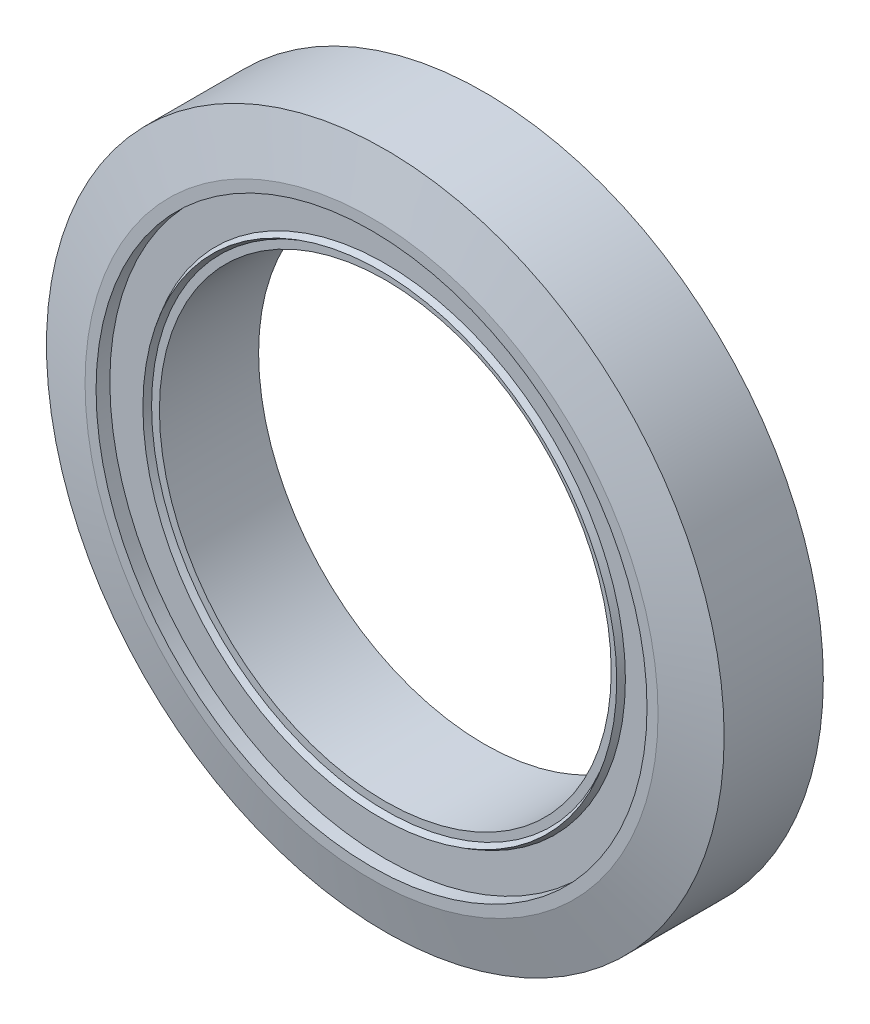
from build123d import *


with BuildPart() as part:
    # Sketch2 → Revolve2 (revolve)
    with BuildSketch(Plane(origin=(0, 0, 0), x_dir=(0, 0, -1), z_dir=(1, 0, 0))):
        Polygon((-0.9, 6.15), (0.9, 6.15), (1.15, 5.2), (1.15, 5), (0.9, 5), (0.9, 4.357735027), (1, 4.3), (0.9, 4.242264973), (0.9, 4.1), (-0.9, 4.1), (-0.9, 4.242264973), (-1, 4.3), (-0.9, 4.357735027), (-0.9, 5), (-1.15, 5), (-1.15, 5.2), align=None)
    revolve(axis=Axis((0, 0, 0), (0, 0, -1)))


solid = part.part
